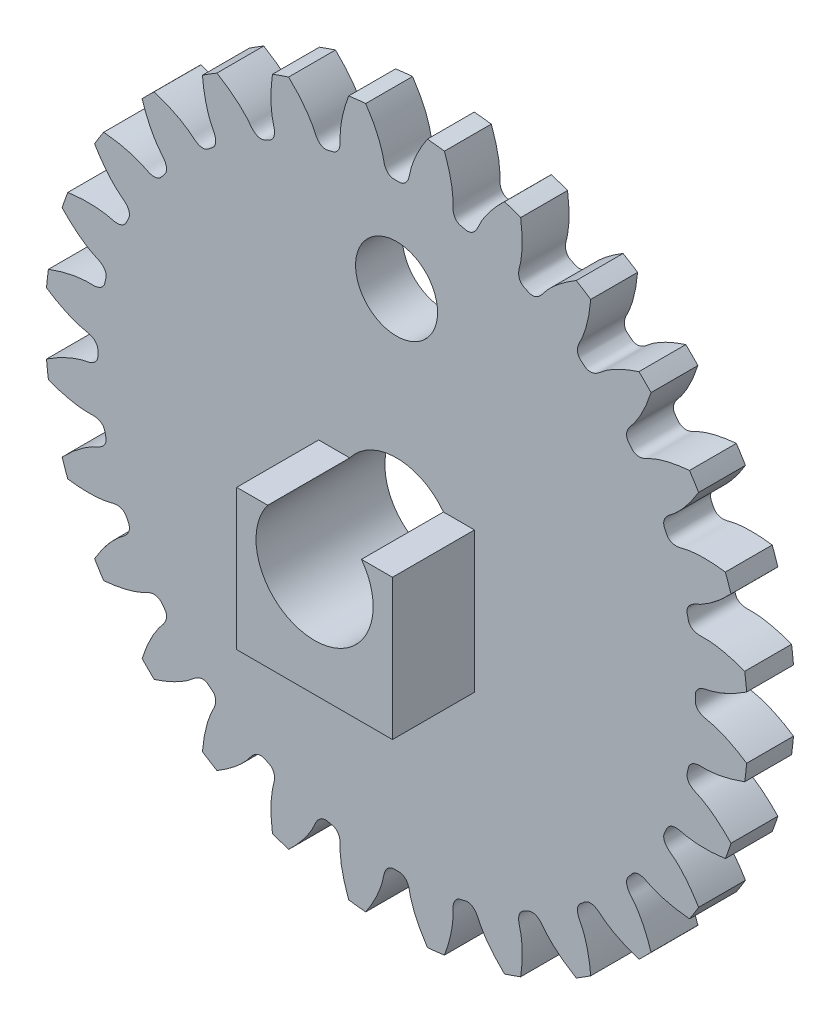
from build123d import *

# Parameters (mm, degrees)
SKETCH_348_W               = 4
SKETCH_348_H               = 29.999999549
CUT_EXTRUDE_597_DEPTH      = 2
PATTERN_CIRCULAR_649_COUNT = 28
SKETCH_1_R                 = 5
SKETCH_1_R_2               = 3.5
CUT_EXTRUDE_1_DEPTH        = 10
EXTRUDE_START              = 7
EXTRUDE_1_DEPTH            = 7


with BuildPart() as part:
    # Sketch 348 → Revolve 374 (revolve)
    with BuildSketch(Plane(origin=(0, 0, 0), x_dir=(0, 0, -1), z_dir=(1, 0, 0))):
        with Locations((0, 14.999999775)):
            Rectangle(SKETCH_348_W, SKETCH_348_H)
    revolve(axis=Axis((0, 0, 0), (0, 0, -1)))

    # Sketch 417 → Cut-Extrude 597 (cut, symmetric)
    with BuildSketch(Plane.XY):
        with BuildLine():
            ThreePointArc((29.979072864, 2.695396631), (30.099999548, 0), (29.979072864, -2.695396631))
            add(Edge.make_bspline(
                [(29.979072864, -2.695396631), (29.896664854, -2.639402783), (29.786730618, -2.566335651), (29.64893706, -2.477521349), (29.568035728, -2.426168463), (29.487855941, -2.376051375), (29.408410914, -2.32715756), (29.32971372, -2.27947436), (29.251777289, -2.232988998), (29.174614412, -2.187688575), (29.098237735, -2.143560072), (29.022659762, -2.100590353), (28.947892852, -2.058766165), (28.873949218, -2.01807414), (28.800840925, -1.978500794), (28.728579892, -1.940032533), (28.657177888, -1.902655649), (28.586646534, -1.866356328), (28.516997298, -1.831120643), (28.448241499, -1.796934564), (28.3803903, -1.763783953), (28.313454714, -1.73165457), (28.247445598, -1.700532069), (28.182373653, -1.670402007), (28.118249426, -1.641249839), (28.055083305, -1.613060921), (27.992885522, -1.585820515), (27.931666148, -1.559513784), (27.871435096, -1.534125801), (27.812202118, -1.509641545), (27.753976807, -1.486045903), (27.69676859, -1.463323675), (27.640586735, -1.441459573), (27.585440345, -1.420438221), (27.531338358, -1.400244159), (27.47828955, -1.380861846), (27.426302527, -1.362275657), (27.375385733, -1.344469888), (27.325547441, -1.327428756), (27.27679576, -1.311136401), (27.229138627, -1.295576889), (27.182583813, -1.280734211), (27.137138918, -1.266592286), (27.092811371, -1.253134963), (27.04960843, -1.240346022), (27.007537184, -1.228209174), (26.966604547, -1.216708066), (26.926817261, -1.20582628), (26.888181897, -1.195547337), (26.850704848, -1.185854694), (26.814392336, -1.17673175), (26.779250408, -1.16816185), (26.745284935, -1.160128271), (26.712501608, -1.152614272), (26.680905961, -1.145602933), (26.650503284, -1.139077723), (26.621298921, -1.133020525), (26.593297236, -1.127418549), (26.566505215, -1.122240184), (26.49636452, -1.109297748), (26.415822113, -1.094870624), (26.326101454, -1.073018121), (26.270385723, -1.057904532), (26.215902803, -1.041347253), (26.162540433, -1.0232722), (26.110181619, -1.003524941), (26.058695071, -0.981917682), (26.007940619, -0.958202199), (25.957774435, -0.932058707), (25.908060562, -0.903076729), (25.858690873, -0.870735014), (25.809618426, -0.834381219), (25.7609102, -0.793217568), (25.712825496, -0.746303832), (25.665922797, -0.692597782), (25.621186554, -0.631061966), (25.580139178, -0.560870703), (25.544871763, -0.481720462), (25.51787614, -0.394228008), (25.502614077, -0.30556407), (25.496187467, -0.173371937), (25.502777671, 0), (25.496187467, 0.173371937), (25.502614077, 0.30556407), (25.51787614, 0.394228008), (25.544871763, 0.481720462), (25.580139178, 0.560870703), (25.621186554, 0.631061966), (25.665922797, 0.692597782), (25.712825496, 0.746303832), (25.7609102, 0.793217568), (25.809618426, 0.834381219), (25.858690873, 0.870735014), (25.908060562, 0.903076729), (25.957774435, 0.932058707), (26.007940619, 0.958202199), (26.058695071, 0.981917682), (26.110181619, 1.003524941), (26.162540433, 1.0232722), (26.215902803, 1.041347253), (26.270385723, 1.057904532), (26.326101454, 1.073018121), (26.415822113, 1.094870624), (26.49636452, 1.109297748), (26.566505215, 1.122240184), (26.593297236, 1.127418549), (26.621298921, 1.133020525), (26.650503284, 1.139077723), (26.680905961, 1.145602933), (26.712501608, 1.152614272), (26.745284935, 1.160128271), (26.779250408, 1.16816185), (26.814392336, 1.17673175), (26.850704848, 1.185854694), (26.888181897, 1.195547337), (26.926817261, 1.20582628), (26.966604547, 1.216708066), (27.007537184, 1.228209174), (27.04960843, 1.240346022), (27.092811371, 1.253134963), (27.137138918, 1.266592286), (27.182583813, 1.280734211), (27.229138627, 1.295576889), (27.27679576, 1.311136401), (27.325547441, 1.327428756), (27.375385733, 1.344469888), (27.426302527, 1.362275657), (27.47828955, 1.380861846), (27.531338358, 1.400244159), (27.585440345, 1.420438221), (27.640586735, 1.441459573), (27.69676859, 1.463323675), (27.753976807, 1.486045903), (27.812202118, 1.509641545), (27.871435096, 1.534125801), (27.931666148, 1.559513784), (27.992885522, 1.585820515), (28.055083305, 1.613060921), (28.118249426, 1.641249839), (28.182373653, 1.670402007), (28.247445598, 1.700532069), (28.313454714, 1.73165457), (28.3803903, 1.763783953), (28.448241499, 1.796934564), (28.516997298, 1.831120643), (28.586646534, 1.866356328), (28.657177888, 1.902655649), (28.728579892, 1.940032533), (28.800840925, 1.978500794), (28.873949218, 2.01807414), (28.947892852, 2.058766165), (29.022659762, 2.100590353), (29.098237735, 2.143560072), (29.174614412, 2.187688575), (29.251777289, 2.232988998), (29.32971372, 2.27947436), (29.408410914, 2.32715756), (29.487855941, 2.376051375), (29.568035728, 2.426168463), (29.64893706, 2.477521349), (29.786730618, 2.566335651), (29.896664854, 2.639402783), (29.979072864, 2.695396631)],
                knots=[0, 0, 0, 0, 0.027016575, 0.035792695, 0.044454095, 0.053000774, 0.061432733, 0.069749971, 0.077952489, 0.086040286, 0.094013363, 0.101871719, 0.109615354, 0.117244269, 0.124758464, 0.132157938, 0.139442691, 0.146612724, 0.153668037, 0.160608629, 0.1674345, 0.174145651, 0.180742081, 0.187223791, 0.19359078, 0.199843049, 0.205980597, 0.212003425, 0.217911532, 0.223704918, 0.229383585, 0.23494753, 0.240396755, 0.24573126, 0.250951044, 0.256056107, 0.26104645, 0.265922072, 0.270682974, 0.275329156, 0.279860617, 0.284277357, 0.288579377, 0.292766676, 0.296839255, 0.300797113, 0.30464025, 0.308368667, 0.311982364, 0.31548134, 0.318865596, 0.322135131, 0.325289945, 0.328330039, 0.331255413, 0.334066066, 0.336761998, 0.33934321, 0.341809701, 0.344161472, 0.358684959, 0.363984217, 0.369197068, 0.374337728, 0.379422889, 0.384472211, 0.389508909, 0.39456044, 0.399659263, 0.404843661, 0.410158492, 0.415655702, 0.42139421, 0.427438563, 0.433855426, 0.440706718, 0.44803836, 0.455864745, 0.464151755, 0.472805001, 0.480182001, 0.5, 0.519817999, 0.527194999, 0.535848245, 0.544135255, 0.55196164, 0.559293282, 0.566144574, 0.572561437, 0.57860579, 0.584344298, 0.589841508, 0.595156339, 0.600340737, 0.60543956, 0.610491091, 0.615527789, 0.620577111, 0.625662272, 0.630802932, 0.636015783, 0.641315041, 0.655838528, 0.658190299, 0.66065679, 0.663238002, 0.665933934, 0.668744587, 0.671669961, 0.674710055, 0.677864869, 0.681134404, 0.68451866, 0.688017636, 0.691631333, 0.69535975, 0.699202887, 0.703160745, 0.707233324, 0.711420623, 0.715722643, 0.720139383, 0.724670844, 0.729317026, 0.734077928, 0.73895355, 0.743943893, 0.749048956, 0.75426874, 0.759603245, 0.76505247, 0.770616415, 0.776295082, 0.782088468, 0.787996575, 0.794019403, 0.800156951, 0.80640922, 0.812776209, 0.819257919, 0.825854349, 0.8325655, 0.839391371, 0.846331963, 0.853387276, 0.860557309, 0.867842062, 0.875241536, 0.882755731, 0.890384646, 0.898128281, 0.905986637, 0.913959714, 0.922047511, 0.930250029, 0.938567267, 0.946999226, 0.955545905, 0.964207305, 0.972983425, 1, 1, 1, 1], degree=3))
        make_face()
    cut_extrude_597 = extrude(amount=CUT_EXTRUDE_597_DEPTH, both=True, mode=Mode.SUBTRACT)

    # Pattern Circular 649: Cut-Extrude 597 ×28 about axis
    pattern_circular_649_axis = Axis((0, 0, 55), (0, 0, -1))
    for i in range(1, PATTERN_CIRCULAR_649_COUNT):
        add(cut_extrude_597.rotate(pattern_circular_649_axis, i * 360 / PATTERN_CIRCULAR_649_COUNT), mode=Mode.SUBTRACT)

    # 草图1 → 切除-拉伸1 (cut)
    with BuildSketch(Plane.XY.offset(2)):
        Circle(SKETCH_1_R)
        with Locations((0, 17.5)):
            Circle(SKETCH_1_R_2)
    extrude(amount=-CUT_EXTRUDE_1_DEPTH, mode=Mode.SUBTRACT)

    # 草图2 → 凸台-拉伸1 (add)
    with BuildSketch(Plane.XY.offset(2).offset(EXTRUDE_START)):
        with BuildLine():
            Line((-4, 3), (-6.65, 3))
            Line((-6.65, 3), (-6.65, -9))
            Line((-6.65, -9), (6.65, -9))
            Line((6.65, -9), (6.65, 3))
            Line((6.65, 3), (4, 3))
            ThreePointArc((4, 3), (4.74341649, 1.58113883), (5, 0))
            ThreePointArc((5, 0), (-1.58113883, -4.74341649), (-4, 3))
        make_face()
    extrude(amount=-EXTRUDE_1_DEPTH)


solid = part.part
